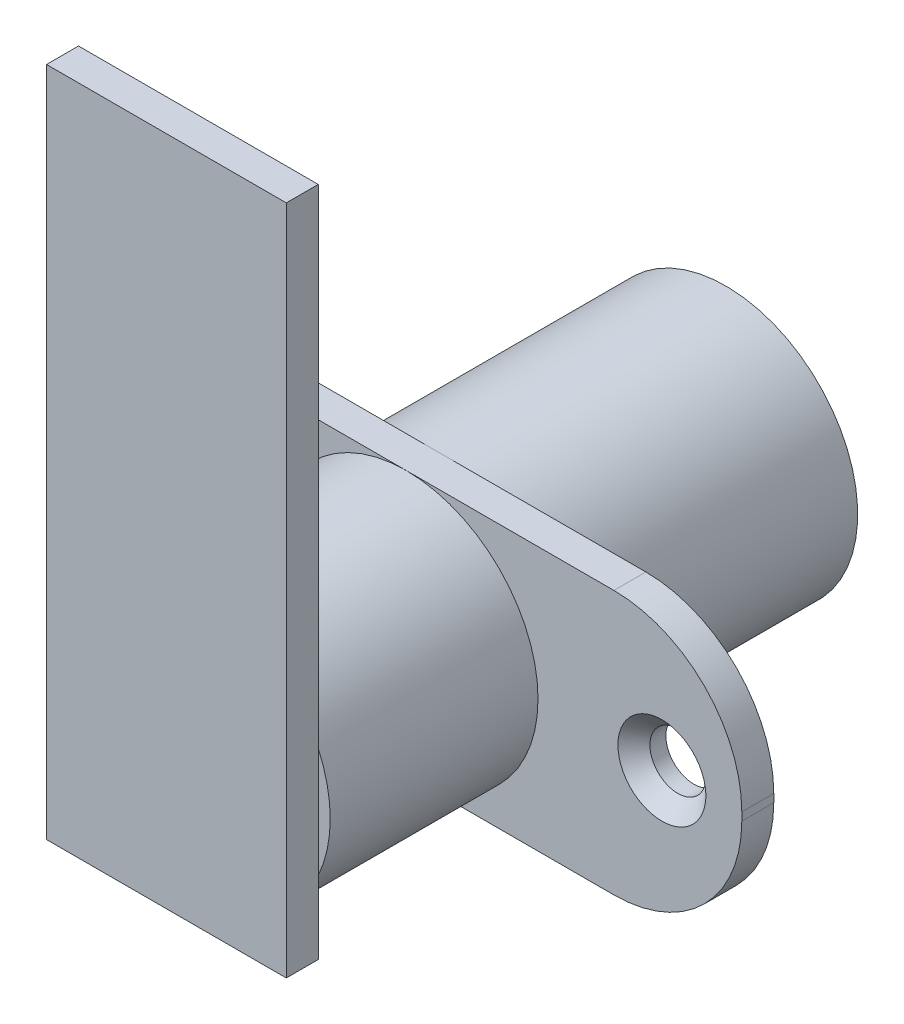
from build123d import *

# Parameters (mm, degrees)
ESQUISSE1_R             = 1.75
BOSS_EXTRU_1_DEPTH      = 2
BOSS_EXTRU_2_DEPTH      = 18
BOSS_EXTRU_2_DEPTH_BACK = 15
ESQUISSE2_R             = 8.25
CHANFREIN1_SIZE         = 1
ESQUISSE3_W             = 15
ESQUISSE3_H             = 42
BOSS_EXTRU_3_DEPTH      = 2


with BuildPart() as part:
    # Esquisse1 → Boss.-Extru.1 (new body)
    with BuildSketch(Plane.XY):
        with BuildLine():
            Line((8, 0), (34, 0))
            ThreePointArc((34, 0), (39.656854249, -2.343145751), (42, -8))
            Line((42, -8), (42, -8.5))
            ThreePointArc((42, -8.5), (39.656854249, -14.156854249), (34, -16.5))
            Line((34, -16.5), (8, -16.5))
            ThreePointArc((8, -16.5), (2.343145751, -14.156854249), (0, -8.5))
            Line((0, -8.5), (0, -8))
            ThreePointArc((0, -8), (2.343145751, -2.343145751), (8, 0))
        make_face()
        with Locations((5, -8.25)):
            Circle(ESQUISSE1_R, mode=Mode.SUBTRACT)
        with Locations((37, -8.25)):
            Circle(ESQUISSE1_R, mode=Mode.SUBTRACT)
    extrude(amount=BOSS_EXTRU_1_DEPTH)

    # Esquisse2 → Boss.-Extru.2 (add, two sides: drawn at the far end of the back side and taken through both)
    with BuildSketch(Plane(origin=(0, 0, 0), x_dir=(-1, 0, 0), z_dir=(0, 0, -1)).offset(-BOSS_EXTRU_2_DEPTH_BACK)):
        with Locations((-21, -8.25)):
            Circle(ESQUISSE2_R)
    extrude(amount=BOSS_EXTRU_2_DEPTH + BOSS_EXTRU_2_DEPTH_BACK)

    # Chanfrein1
    chanfrein1_edges = [part.edges().sort_by_distance(p)[0] for p in [
        (35.25, -8.25, 2),
        (3.25, -8.25, 2),
    ]]
    chamfer(chanfrein1_edges, length=CHANFREIN1_SIZE)

    # Esquisse3 → Boss.-Extru.3 (add)
    with BuildSketch(Plane.XY.offset(15)):
        with Locations((21, 4.75)):
            Rectangle(ESQUISSE3_W, ESQUISSE3_H)
    extrude(amount=BOSS_EXTRU_3_DEPTH)


solid = part.part
